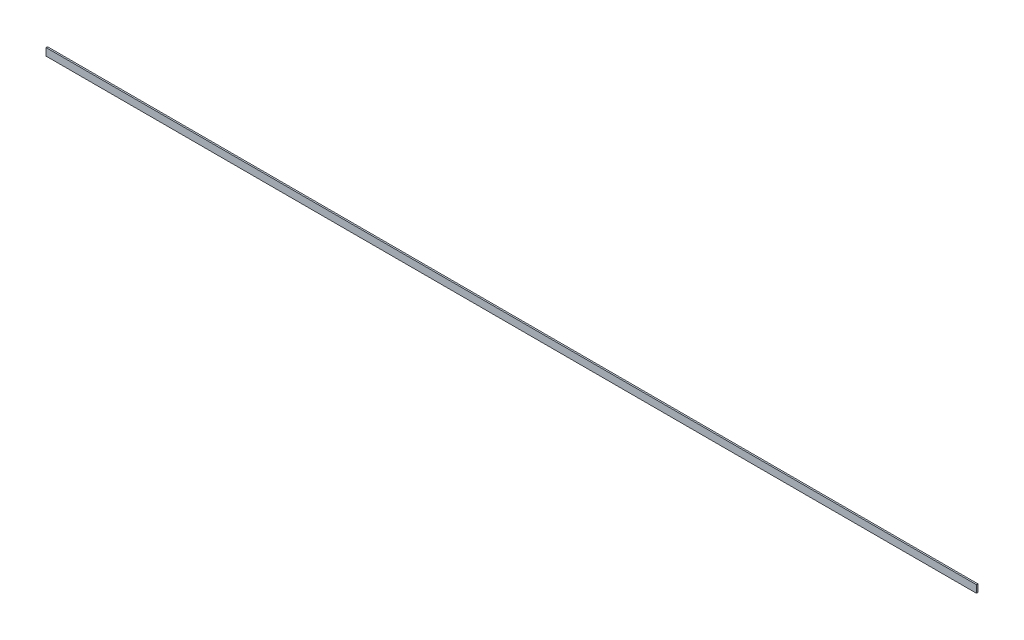
from build123d import *

# Parameters (mm, degrees)
SKETCH_1_W      = 4
SKETCH_1_H      = 20
EXTRUDE_1_DEPTH = 2500


with BuildPart() as part:
    # Эскиз1 → Бобышка-Вытянуть1 (new body)
    with BuildSketch(Plane(origin=(0, 0, 0), x_dir=(0, 0, -1), z_dir=(1, 0, 0))):
        with Locations((2, 10)):
            Rectangle(SKETCH_1_W, SKETCH_1_H)
    extrude(amount=EXTRUDE_1_DEPTH)


solid = part.part
